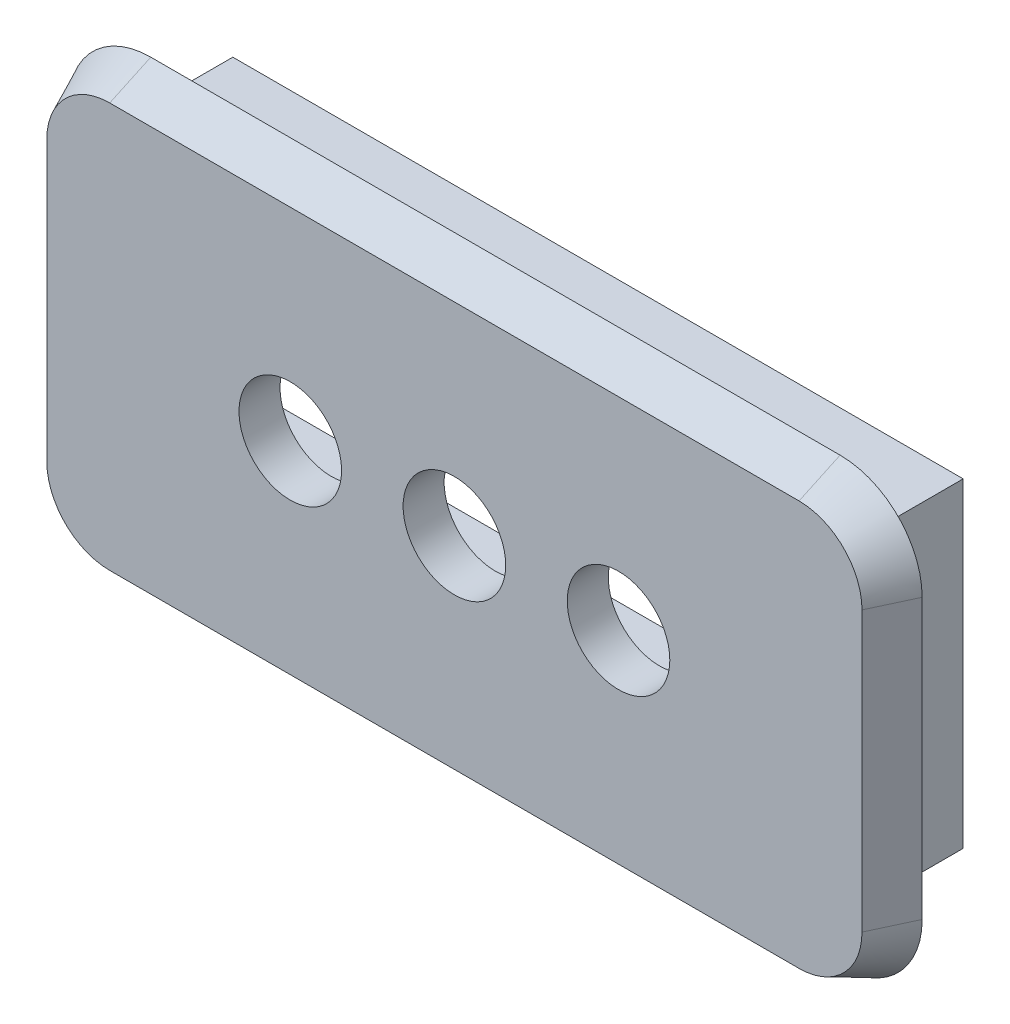
from build123d import *

# Parameters (mm, degrees)
SKETCH_1_W          = 17.8
SKETCH_1_H          = 7.8
SKETCH_1_W_2        = 15.8
SKETCH_1_H_2        = 5.8
EXTRUDE_1_DEPTH     = 2.5
EXTRUDE_2_DEPTH     = 1
EXTRUDE_2_TAPER     = 25
CUT_EXTRUDE_1_REACH = 34.462
SKETCH_3_R          = 1.25


with BuildPart() as part:
    # 草图1 → 凸台-拉伸1 (new body)
    with BuildSketch(Plane.XY):
        with Locations((0.435, 25)):
            Rectangle(SKETCH_1_W, SKETCH_1_H)
        with Locations((0.435, 25)):
            Rectangle(SKETCH_1_W_2, SKETCH_1_H_2, mode=Mode.SUBTRACT)
    extrude(amount=-EXTRUDE_1_DEPTH)

    # 草图2 → 凸台-拉伸2 (add)
    with BuildSketch(Plane.XY):
        with BuildLine():
            Line((10.835, 21.6), (10.835, 28.4))
            ThreePointArc((10.835, 28.4), (10.249213562, 29.814213562), (8.835, 30.4))
            Line((8.835, 30.4), (-7.965, 30.4))
            ThreePointArc((-7.965, 30.4), (-9.379213562, 29.814213562), (-9.965, 28.4))
            Line((-9.965, 28.4), (-9.965, 21.6))
            ThreePointArc((-9.965, 21.6), (-9.379213562, 20.185786438), (-7.965, 19.6))
            Line((-7.965, 19.6), (8.835, 19.6))
            ThreePointArc((8.835, 19.6), (10.249213562, 20.185786438), (10.835, 21.6))
        make_face()
    extrude(amount=EXTRUDE_2_DEPTH, taper=EXTRUDE_2_TAPER)

    # 草图3 → 切除-拉伸1 (cut, up to next)
    with BuildSketch(Plane.XY.offset(1), mode=Mode.PRIVATE) as cut_extrude_1_sk1:
        with Locations((0.435, 25)):
            Circle(SKETCH_3_R)
    cut_extrude_1_tool1 = extrude(cut_extrude_1_sk1.sketch, amount=-CUT_EXTRUDE_1_REACH, mode=Mode.PRIVATE) & part.part
    # 草图3 → 切除-拉伸1 (cut, up to next)
    with BuildSketch(Plane.XY.offset(1), mode=Mode.PRIVATE) as cut_extrude_1_sk2:
        with Locations((-3.565, 25)):
            Circle(SKETCH_3_R)
    cut_extrude_1_tool2 = extrude(cut_extrude_1_sk2.sketch, amount=-CUT_EXTRUDE_1_REACH, mode=Mode.PRIVATE) & part.part
    # 草图3 → 切除-拉伸1 (cut, up to next)
    with BuildSketch(Plane.XY.offset(1), mode=Mode.PRIVATE) as cut_extrude_1_sk3:
        with Locations((4.435, 25)):
            Circle(SKETCH_3_R)
    cut_extrude_1_tool3 = extrude(cut_extrude_1_sk3.sketch, amount=-CUT_EXTRUDE_1_REACH, mode=Mode.PRIVATE) & part.part
    add(cut_extrude_1_tool1.solids().sort_by_distance((0.435, 25, 1))[0], mode=Mode.SUBTRACT)
    add(cut_extrude_1_tool2.solids().sort_by_distance((-3.565, 25, 1))[0], mode=Mode.SUBTRACT)
    add(cut_extrude_1_tool3.solids().sort_by_distance((4.435, 25, 1))[0], mode=Mode.SUBTRACT)


solid = part.part
